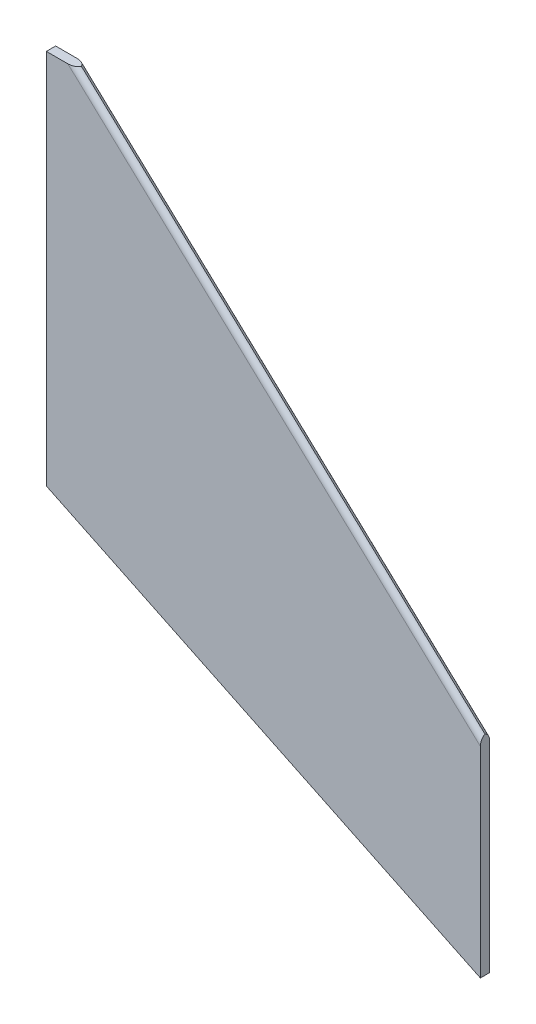
from build123d import *

# Parameters (mm, degrees)
BOSS_EXTRUDE1_DEPTH = 3.81
FILLET1_R           = 2.54


with BuildPart() as part:
    # Sketch2 → Boss-Extrude1 (new body)
    with BuildSketch(Plane.XY):
        Polygon((-24.165117367, -826.289827771), (140.930897986, -980.294891713), (140.930897986, -1065.870274418), (-36.694836072, -980.294891713), (-36.694836072, -826.289827771), align=None)
    extrude(amount=BOSS_EXTRUDE1_DEPTH)

    # Fillet1
    # the kernel refuses this fillet: 2.54 mm, written as the material it takes off along each edge
    with BuildSketch(Plane(origin=(-28.808504328, -821.958377953, 3.81), x_dir=(0, 0, -1), z_dir=(0.7312420410589273, -0.6821180817043146, 0))) as fillet1_piece_1:
        with BuildLine():
            CenterArc((FILLET1_R, -FILLET1_R), FILLET1_R, 90, 90)
            Line((0, -FILLET1_R), (0, 0))
            Line((0, 0), (FILLET1_R, 0))
        make_face()
    extrude(amount=238.474786026, mode=Mode.SUBTRACT)
    with BuildSketch(Plane(origin=(-28.808504328, -821.958377953, 0), x_dir=(0, 0, 1), z_dir=(0.7312420410589273, -0.6821180817043146, 0))) as fillet1_piece_2:
        with BuildLine():
            CenterArc((FILLET1_R, FILLET1_R), FILLET1_R, 180, 90)
            Line((0, FILLET1_R), (0, 0))
            Line((0, 0), (FILLET1_R, 0))
        make_face()
    extrude(amount=238.474786026, mode=Mode.SUBTRACT)


solid = part.part
